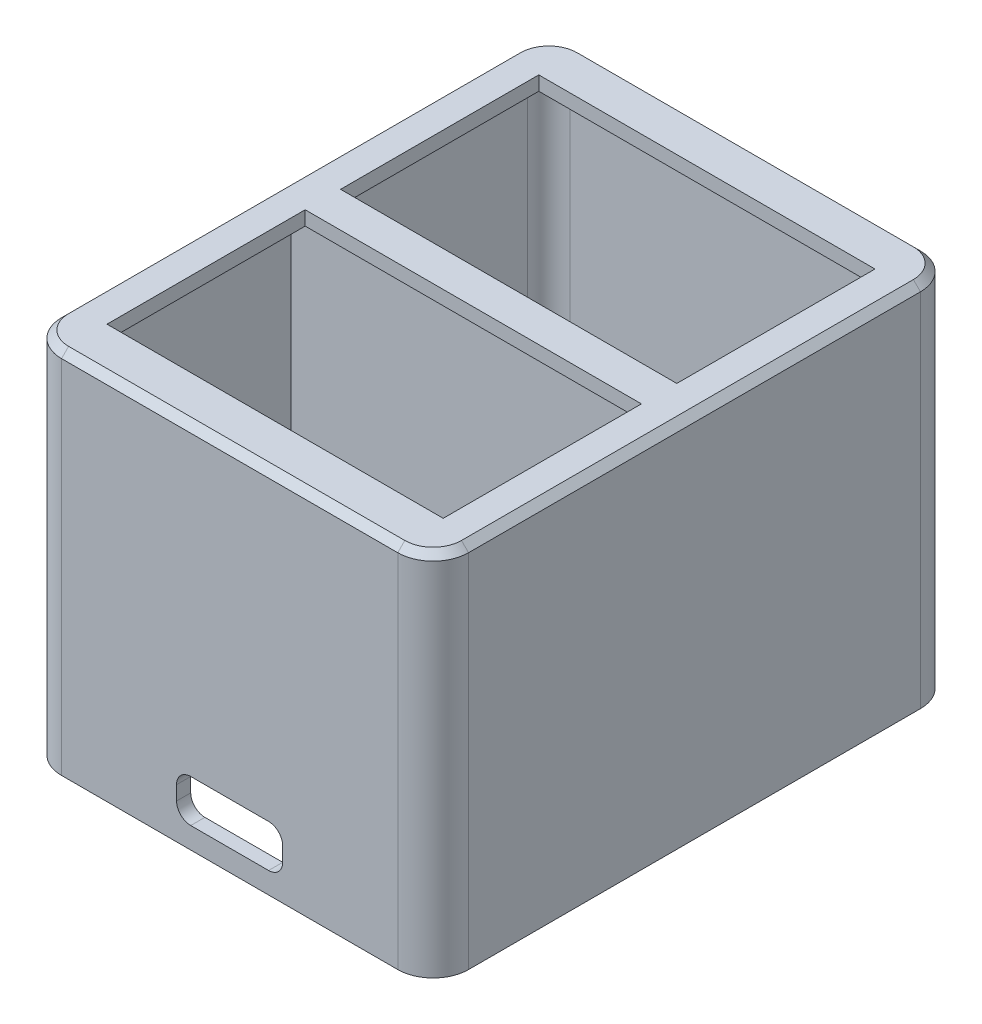
from build123d import *

# Parameters (mm, degrees)
SKETCH2_W           = 57.5
SKETCH2_H           = 73.842105264
SKETCH2_W_2         = 47.5
SKETCH2_H_2         = 28
BOSS_EXTRUDE1_DEPTH = 2
SKETCH3_W           = 57.5
SKETCH3_H           = 73.842105264
SKETCH3_W_2         = 53.5
SKETCH3_H_2         = 33.421052632
BOSS_EXTRUDE2_DEPTH = 50
FILLET1_R           = 3
FILLET2_R           = 5
SKETCH4_W           = 15
SKETCH4_H           = 6
CUT_EXTRUDE1_DEPTH  = 4
FILLET3_R           = 2
CHAMFER1_SIZE       = 1
SKETCH6_W           = 13
SKETCH6_H           = 8
SKETCH6_R           = 1.75
BOSS_EXTRUDE3_DEPTH = 2.5
FILLET4_R           = 3


with BuildPart() as part:
    # Sketch2 → Boss-Extrude1 (new body)
    with BuildSketch(Plane(origin=(0, 0, 0), x_dir=(1, 0, 0), z_dir=(0, 1, 0))):
        Rectangle(SKETCH2_W, SKETCH2_H)
        with Locations((0, -16.5)):
            Rectangle(SKETCH2_W_2, SKETCH2_H_2, mode=Mode.SUBTRACT)
        with Locations((0, 16.5)):
            Rectangle(SKETCH2_W_2, SKETCH2_H_2, mode=Mode.SUBTRACT)
    extrude(amount=BOSS_EXTRUDE1_DEPTH)

    # Sketch3 → Boss-Extrude2 (add)
    with BuildSketch(Plane.XZ):
        Rectangle(SKETCH3_W, SKETCH3_H)
        with Locations((0, -18.210526316)):
            Rectangle(SKETCH3_W_2, SKETCH3_H_2, mode=Mode.SUBTRACT)
        with Locations((0, 18.210526316)):
            Rectangle(SKETCH3_W_2, SKETCH3_H_2, mode=Mode.SUBTRACT)
    extrude(amount=BOSS_EXTRUDE2_DEPTH)

    # Fillet1
    fillet1_edges = [part.edges().sort_by_distance(p)[0] for p in [
        (-26.75, -25, 34.921052632),
        (26.75, -25, -34.921052632),
        (-26.75, -25, -34.921052632),
        (26.75, -25, 34.921052632),
    ]]
    fillet(fillet1_edges, radius=FILLET1_R)

    # Fillet2
    fillet2_edges = [part.edges().sort_by_distance(p)[0] for p in [
        (-28.75, -24, 36.921052632),
        (-28.75, -24, -36.921052632),
        (28.75, -24, -36.921052632),
        (28.75, -24, 36.921052632),
    ]]
    fillet(fillet2_edges, radius=FILLET2_R)

    # Sketch4 → Cut-Extrude1 (cut)
    with BuildSketch(Plane.XY.offset(36.921052632)):
        with Locations((0, -44)):
            Rectangle(SKETCH4_W, SKETCH4_H)
    cut_extrude1 = extrude(amount=-CUT_EXTRUDE1_DEPTH, mode=Mode.SUBTRACT)

    # Mirror2: Cut-Extrude1 across plane
    add(cut_extrude1.mirror(Plane.XY), mode=Mode.SUBTRACT)

    # Fillet3
    fillet3_edges = [part.edges().sort_by_distance(p)[0] for p in [
        (7.5, -41, 35.921052632),
        (-7.5, -41, 35.921052632),
        (7.5, -41, -35.921052632),
        (-7.5, -41, -35.921052632),
        (7.5, -47, 35.921052632),
        (-7.5, -47, 35.921052632),
        (-7.5, -47, -35.921052632),
        (7.5, -47, -35.921052632),
    ]]
    fillet(fillet3_edges, radius=FILLET3_R)

    # Chamfer1
    chamfer1_edges = [part.edges().sort_by_distance(p)[0] for p in [
        (-27.285533906, 2, -35.456586538),
        (-28.75, 2, 0),
        (0, 2, -36.921052632),
        (-27.285533906, 2, 35.456586538),
        (27.285533906, 2, -35.456586538),
        (0, 2, 36.921052632),
        (28.75, 2, 0),
        (27.285533906, 2, 35.456586538),
    ]]
    chamfer(chamfer1_edges, length=CHAMFER1_SIZE)

    # Sketch6 → Boss-Extrude3 (add)
    # profile 1 of 2: a face of its own
    with BuildSketch(Plane.XZ.offset(50)):
        with Locations((-20.25, 16.5)):
            Rectangle(SKETCH6_W, SKETCH6_H)
        with Locations((-18.75, 16.5)):
            Circle(SKETCH6_R, mode=Mode.SUBTRACT)
    # profile 2 of 2: a face of its own
    with BuildSketch(Plane.XZ.offset(50)):
        with Locations((20.25, 16.5)):
            Rectangle(SKETCH6_W, SKETCH6_H)
        with Locations((18.75, 16.5)):
            Circle(SKETCH6_R, mode=Mode.SUBTRACT)
    boss_extrude3 = extrude(amount=-BOSS_EXTRUDE3_DEPTH)

    # Mirror1: Boss-Extrude3 across plane
    add(boss_extrude3.mirror(Plane.XY))

    # Fillet4
    fillet4_edges = [part.edges().sort_by_distance(p)[0] for p in [
        (-13.75, -48.75, 12.5),
        (-26.75, -48.75, 12.5),
        (-26.75, -48.75, 20.5),
        (-13.75, -48.75, 20.5),
        (-13.75, -48.75, -12.5),
        (-13.75, -48.75, -20.5),
        (26.75, -48.75, -12.5),
        (-26.75, -48.75, -20.5),
        (-26.75, -48.75, -12.5),
        (26.75, -48.75, -20.5),
        (13.75, -48.75, -20.5),
        (13.75, -48.75, -12.5),
        (26.75, -48.75, 12.5),
        (26.75, -48.75, 20.5),
        (13.75, -48.75, 20.5),
        (13.75, -48.75, 12.5),
    ]]
    fillet(fillet4_edges, radius=FILLET4_R)


solid = part.part
